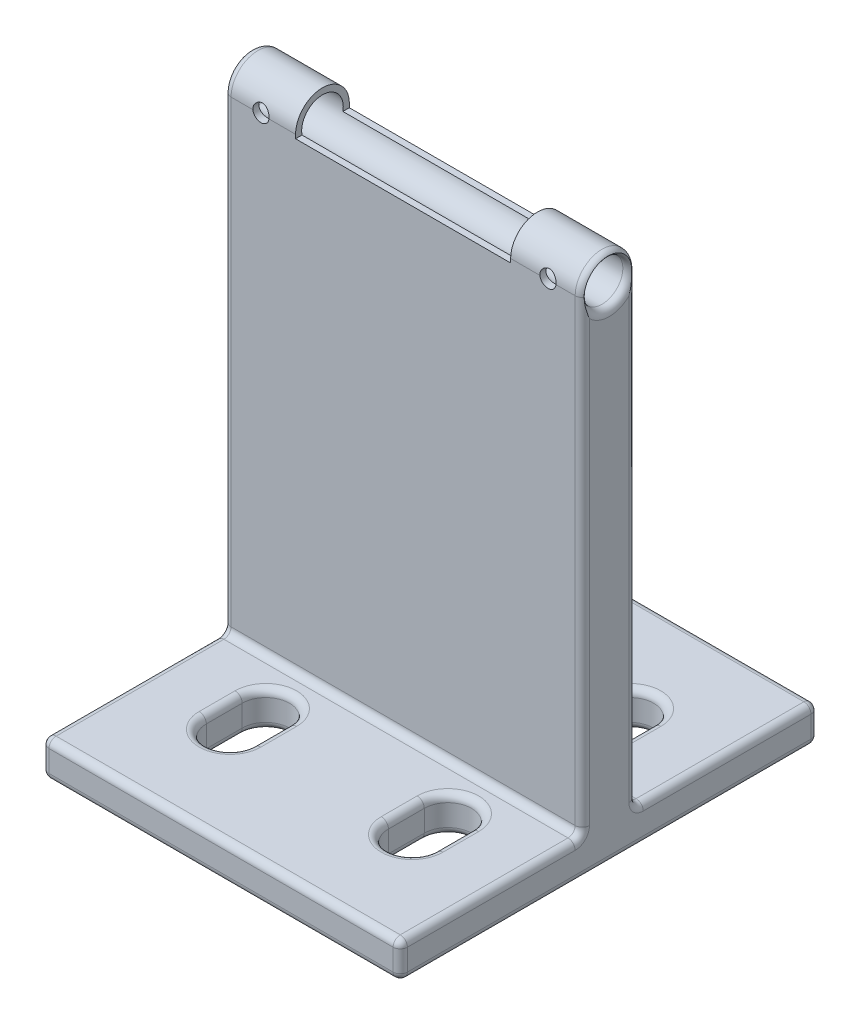
from build123d import *

# Parameters (mm, degrees)
SKETCH1_R                = 2.9
BOSS_EXTRUDE1_DEPTH      = 50
SKETCH2_W                = 30
SKETCH2_H                = 6.129245945
CUT_EXTRUDE1_DEPTH       = 50
BOSS_EXTRUDE2_DEPTH      = 25.4
BOSS_EXTRUDE2_DEPTH_BACK = 32.9
SKETCH3_W                = 50
SKETCH3_H                = 5
CUT_EXTRUDE2_DEPTH       = 25.4
F_4_40_SCREW_R           = 1.1303
CUT_EXTRUDE5_DEPTH       = 84.068274931
FILLET2_R                = 1


with BuildPart() as part:
    # Sketch1 → Boss-Extrude1 (new body)
    with BuildSketch(Plane(origin=(0, 0, 0), x_dir=(0, 0, -1), z_dir=(1, 0, 0))):
        with BuildLine():
            Line((-8.071724478, 6.76056338), (-8.071724478, -16.478873239))
            Line((-8.071724478, -16.478873239), (-0.571724478, -16.478873239))
            Line((-0.571724478, -16.478873239), (-0.571724478, 6.76056338))
            Line((-0.571724478, 6.76056338), (-0.571724478, 53.521126761))
            ThreePointArc((-0.571724478, 53.521126761), (-4.321724478, 57.271126761), (-8.071724478, 53.521126761))
            Line((-8.071724478, 53.521126761), (-8.071724478, 6.76056338))
        make_face()
        with Locations((-4.321724478, 53.521126761)):
            Circle(SKETCH1_R, mode=Mode.SUBTRACT)
    extrude(amount=BOSS_EXTRUDE1_DEPTH)

    # Sketch2 → Cut-Extrude1 (cut)
    with BuildSketch(Plane.XY.offset(8.071724478)):
        with Locations((25, 56.047993435)):
            Rectangle(SKETCH2_W, SKETCH2_H)
    extrude(amount=-CUT_EXTRUDE1_DEPTH, mode=Mode.SUBTRACT)

    # Sketch3 → Boss-Extrude2 (add, two sides: drawn at the far end of the back side and taken through both)
    with BuildSketch(Plane.XY.offset(8.071724478).offset(-BOSS_EXTRUDE2_DEPTH_BACK)):
        with Locations((25, -13.978873239)):
            Rectangle(SKETCH3_W, SKETCH3_H)
    extrude(amount=BOSS_EXTRUDE2_DEPTH + BOSS_EXTRUDE2_DEPTH_BACK)

    # Sketch4 → Cut-Extrude2 (cut)
    with BuildSketch(Plane.XZ.offset(16.478873239)):
        with BuildLine():
            Line((34.4, -10.878275522), (34.4, -5.878275522))
            ThreePointArc((34.4, -5.878275522), (37.7, -2.578275522), (41, -5.878275522))
            Line((41, -5.878275522), (41, -10.878275522))
            ThreePointArc((41, -10.878275522), (37.7, -14.178275522), (34.4, -10.878275522))
        make_face()
        with BuildLine():
            Line((9, -10.878275522), (9, -5.878275522))
            ThreePointArc((9, -5.878275522), (12.3, -2.578275522), (15.6, -5.878275522))
            Line((15.6, -5.878275522), (15.6, -10.878275522))
            ThreePointArc((15.6, -10.878275522), (12.3, -14.178275522), (9, -10.878275522))
        make_face()
        with BuildLine():
            Line((34.4, 14.521724478), (34.4, 19.521724478))
            ThreePointArc((34.4, 19.521724478), (37.7, 22.821724478), (41, 19.521724478))
            Line((41, 19.521724478), (41, 14.521724478))
            ThreePointArc((41, 14.521724478), (37.7, 11.221724478), (34.4, 14.521724478))
        make_face()
        with BuildLine():
            Line((9, 14.521724478), (9, 19.521724478))
            ThreePointArc((9, 19.521724478), (12.3, 22.821724478), (15.6, 19.521724478))
            Line((15.6, 19.521724478), (15.6, 14.521724478))
            ThreePointArc((15.6, 14.521724478), (12.3, 11.221724478), (9, 14.521724478))
        make_face()
    extrude(amount=-CUT_EXTRUDE2_DEPTH, mode=Mode.SUBTRACT)

    # 4-40 screw → Cut-Extrude5 (cut, through all)
    with BuildSketch(Plane.XY):
        with Locations(Location((45.202679855, 53.6471646, 0), (0, 0, 180))):
            Circle(F_4_40_SCREW_R)
        with Locations(Location((5.165796807, 53.6471646, 0), (0, 0, 353.597729853))):
            Circle(F_4_40_SCREW_R)
    extrude(amount=CUT_EXTRUDE5_DEPTH, mode=Mode.SUBTRACT)

    # Fillet2
    # the kernel refuses this fillet: 1 mm, written as the material it adds along each edge
    with BuildSketch(Plane(origin=(0, -11.478873239, 0.571724478), x_dir=(0, 0, -1), z_dir=(1, 0, 0))) as fillet2_piece_1:
        with BuildLine():
            CenterArc((FILLET2_R, FILLET2_R), FILLET2_R, 180, 90)
            Line((0, FILLET2_R), (0, 0))
            Line((0, 0), (FILLET2_R, 0))
        make_face()
    extrude(amount=50)
    with BuildSketch(Plane(origin=(50, -11.478873239, 8.071724478), x_dir=(0, 1, 0), z_dir=(-1, 0, 0))) as fillet2_piece_2:
        with BuildLine():
            CenterArc((FILLET2_R, -FILLET2_R), FILLET2_R, 90, 90)
            Line((0, -FILLET2_R), (0, 0))
            Line((0, 0), (FILLET2_R, 0))
        make_face()
    extrude(amount=50)
    # the kernel refuses this fillet: 1 mm, written as the material it takes off along each edge
    with BuildSketch(Plane(origin=(49, -15.478873239, -23.828275522), x_dir=(0, 0, -1), z_dir=(0, -1, 0))) as fillet2_2_piece_1_section:
        Polygon((0, 0), (FILLET2_R, 0), (FILLET2_R, FILLET2_R), (0, FILLET2_R), align=None)
    fillet2_2_piece_1 = extrude(amount=FILLET2_R, mode=Mode.PRIVATE)
    fillet2_2_piece_1 = fillet2_2_piece_1 - Plane(origin=(49, -15.478873239, -23.828275522), x_dir=(-0.7071067811865475, 0, 0.7071067811865475), z_dir=(0, -1, 0)) * Sphere(FILLET2_R, mode=Mode.PRIVATE)
    add(fillet2_2_piece_1, mode=Mode.SUBTRACT)
    with BuildSketch(Plane(origin=(49, -15.478873239, 32.471724478), x_dir=(0, 0, 1), z_dir=(0, -1, 0))) as fillet2_2_piece_2_section:
        Polygon((0, 0), (FILLET2_R, 0), (FILLET2_R, -FILLET2_R), (0, -FILLET2_R), align=None)
    fillet2_2_piece_2 = extrude(amount=FILLET2_R, mode=Mode.PRIVATE)
    fillet2_2_piece_2 = fillet2_2_piece_2 - Plane(origin=(49, -15.478873239, 32.471724478), x_dir=(-0.7071067811865475, 0, -0.7071067811865475), z_dir=(0, -1, 0)) * Sphere(FILLET2_R, mode=Mode.PRIVATE)
    add(fillet2_2_piece_2, mode=Mode.SUBTRACT)
    with BuildSketch(Plane(origin=(1, -12.478873239, -23.828275522), x_dir=(0, 0, -1), z_dir=(-1, 0, 0))) as fillet2_2_piece_3_section:
        Polygon((0, 0), (FILLET2_R, 0), (FILLET2_R, -FILLET2_R), (0, -FILLET2_R), align=None)
    fillet2_2_piece_3 = extrude(amount=FILLET2_R, mode=Mode.PRIVATE)
    fillet2_2_piece_3 = fillet2_2_piece_3 - Plane(origin=(1, -12.478873239, -23.828275522), x_dir=(0, -0.7071067811865475, 0.7071067811865475), z_dir=(-1, 0, 0)) * Sphere(FILLET2_R, mode=Mode.PRIVATE)
    add(fillet2_2_piece_3, mode=Mode.SUBTRACT)
    with BuildSketch(Plane(origin=(1, -15.478873239, -23.828275522), x_dir=(-1, 0, 0), z_dir=(0, -1, 0))) as fillet2_2_piece_4_section:
        Polygon((0, 0), (FILLET2_R, 0), (FILLET2_R, FILLET2_R), (0, FILLET2_R), align=None)
    fillet2_2_piece_4 = extrude(amount=FILLET2_R, mode=Mode.PRIVATE)
    fillet2_2_piece_4 = fillet2_2_piece_4 - Plane(origin=(1, -15.478873239, -23.828275522), x_dir=(0.7071067811865475, 0, 0.7071067811865475), z_dir=(0, -1, 0)) * Sphere(FILLET2_R, mode=Mode.PRIVATE)
    add(fillet2_2_piece_4, mode=Mode.SUBTRACT)
    with BuildSketch(Plane(origin=(1, -12.478873239, 32.471724478), x_dir=(0, 0, 1), z_dir=(-1, 0, 0))) as fillet2_2_piece_5_section:
        Polygon((0, 0), (FILLET2_R, 0), (FILLET2_R, FILLET2_R), (0, FILLET2_R), align=None)
    fillet2_2_piece_5 = extrude(amount=FILLET2_R, mode=Mode.PRIVATE)
    fillet2_2_piece_5 = fillet2_2_piece_5 - Plane(origin=(1, -12.478873239, 32.471724478), x_dir=(0, -0.7071067811865475, -0.7071067811865475), z_dir=(-1, 0, 0)) * Sphere(FILLET2_R, mode=Mode.PRIVATE)
    add(fillet2_2_piece_5, mode=Mode.SUBTRACT)
    with BuildSketch(Plane(origin=(49, -12.478873239, -23.828275522), x_dir=(1, 0, 0), z_dir=(0, 0, -1))) as fillet2_2_piece_6_section:
        Polygon((0, 0), (FILLET2_R, 0), (FILLET2_R, -FILLET2_R), (0, -FILLET2_R), align=None)
    fillet2_2_piece_6 = extrude(amount=FILLET2_R, mode=Mode.PRIVATE)
    fillet2_2_piece_6 = fillet2_2_piece_6 - Plane(origin=(49, -12.478873239, -23.828275522), x_dir=(-0.7071067811865475, -0.7071067811865475, 0), z_dir=(0, 0, -1)) * Sphere(FILLET2_R, mode=Mode.PRIVATE)
    add(fillet2_2_piece_6, mode=Mode.SUBTRACT)
    with BuildSketch(Plane(origin=(49, -12.478873239, 32.471724478), x_dir=(0, 0, 1), z_dir=(0, 1, 0))) as fillet2_2_piece_7_section:
        Polygon((0, 0), (FILLET2_R, 0), (FILLET2_R, FILLET2_R), (0, FILLET2_R), align=None)
    fillet2_2_piece_7 = extrude(amount=FILLET2_R, mode=Mode.PRIVATE)
    fillet2_2_piece_7 = fillet2_2_piece_7 - Plane(origin=(49, -12.478873239, 32.471724478), x_dir=(-0.7071067811865475, 0, -0.7071067811865475), z_dir=(0, 1, 0)) * Sphere(FILLET2_R, mode=Mode.PRIVATE)
    add(fillet2_2_piece_7, mode=Mode.SUBTRACT)
    with BuildSketch(Plane(origin=(1, -15.478873239, 32.471724478), x_dir=(-1, 0, 0), z_dir=(0, -1, 0))) as fillet2_2_piece_8_section:
        Polygon((0, 0), (FILLET2_R, 0), (FILLET2_R, -FILLET2_R), (0, -FILLET2_R), align=None)
    fillet2_2_piece_8 = extrude(amount=FILLET2_R, mode=Mode.PRIVATE)
    fillet2_2_piece_8 = fillet2_2_piece_8 - Plane(origin=(1, -15.478873239, 32.471724478), x_dir=(0.7071067811865475, 0, -0.7071067811865475), z_dir=(0, -1, 0)) * Sphere(FILLET2_R, mode=Mode.PRIVATE)
    add(fillet2_2_piece_8, mode=Mode.SUBTRACT)
    with BuildSketch(Plane(origin=(50, -16.478873239, -23.828275522), x_dir=(-1, 0, 0), z_dir=(0, 0, 1)), Plane(origin=(0, -16.478873239, 32.471724478), x_dir=(1, 0, 0), z_dir=(0, 0, -1))) as fillet2_2_piece_9:
        with BuildLine():
            CenterArc((FILLET2_R, -FILLET2_R), FILLET2_R, 90, 90)
            Line((0, -FILLET2_R), (0, 0))
            Line((0, 0), (FILLET2_R, 0))
        make_face()
    extrude(amount=56.3, mode=Mode.SUBTRACT)
    with BuildSketch(Plane(origin=(41, -11.478873239, 19.521724478), x_dir=(0, -1, 0), z_dir=(0, 0, -1)), Plane(origin=(34.4, -11.478873239, 14.521724478), x_dir=(0, -1, 0), z_dir=(0, 0, 1)), Plane(origin=(41, -16.478873239, 19.521724478), x_dir=(1, 0, 0), z_dir=(0, 0, -1)), Plane(origin=(34.4, -16.478873239, 14.521724478), x_dir=(-1, 0, 0), z_dir=(0, 0, 1)), Plane(origin=(15.6, -11.478873239, 19.521724478), x_dir=(0, -1, 0), z_dir=(0, 0, -1)), Plane(origin=(9, -11.478873239, 14.521724478), x_dir=(0, -1, 0), z_dir=(0, 0, 1)), Plane(origin=(15.6, -16.478873239, 19.521724478), x_dir=(1, 0, 0), z_dir=(0, 0, -1)), Plane(origin=(9, -16.478873239, 14.521724478), x_dir=(-1, 0, 0), z_dir=(0, 0, 1)), Plane(origin=(41, -11.478873239, -5.878275522), x_dir=(0, -1, 0), z_dir=(0, 0, -1)), Plane(origin=(34.4, -11.478873239, -10.878275522), x_dir=(0, -1, 0), z_dir=(0, 0, 1)), Plane(origin=(41, -16.478873239, -5.878275522), x_dir=(1, 0, 0), z_dir=(0, 0, -1)), Plane(origin=(34.4, -16.478873239, -10.878275522), x_dir=(-1, 0, 0), z_dir=(0, 0, 1)), Plane(origin=(15.6, -11.478873239, -5.878275522), x_dir=(0, -1, 0), z_dir=(0, 0, -1)), Plane(origin=(9, -11.478873239, -10.878275522), x_dir=(0, -1, 0), z_dir=(0, 0, 1)), Plane(origin=(15.6, -16.478873239, -5.878275522), x_dir=(1, 0, 0), z_dir=(0, 0, -1)), Plane(origin=(9, -16.478873239, -10.878275522), x_dir=(-1, 0, 0), z_dir=(0, 0, 1))) as fillet2_2_piece_10:
        with BuildLine():
            CenterArc((FILLET2_R, -FILLET2_R), FILLET2_R, 90, 90)
            Line((0, -FILLET2_R), (0, 0))
            Line((0, 0), (FILLET2_R, 0))
        make_face()
    extrude(amount=5, mode=Mode.SUBTRACT)
    with BuildSketch(Plane(origin=(37.7, -11.478873239, 19.521724478), x_dir=(1, 0, 0), z_dir=(0, 0, -1))) as fillet2_2_piece_11:
        with BuildLine():
            CenterArc((3.3 + FILLET2_R, FILLET2_R), FILLET2_R, 180, 90)
            Line((3.3 + FILLET2_R, 0), (3.3, 0))
            Line((3.3, 0), (3.3, FILLET2_R))
        make_face()
    revolve(axis=Axis((37.7, -11.478873239, 19.521724478), (0, -1, 0)), revolution_arc=180, mode=Mode.SUBTRACT)
    with BuildSketch(Plane(origin=(37.7, -11.478873239, 14.521724478), x_dir=(-1, 0, 0), z_dir=(0, 0, 1))) as fillet2_2_piece_12:
        with BuildLine():
            CenterArc((3.3 + FILLET2_R, FILLET2_R), FILLET2_R, 180, 90)
            Line((3.3 + FILLET2_R, 0), (3.3, 0))
            Line((3.3, 0), (3.3, FILLET2_R))
        make_face()
    revolve(axis=Axis((37.7, -11.478873239, 14.521724478), (0, -1, 0)), revolution_arc=180, mode=Mode.SUBTRACT)
    with BuildSketch(Plane(origin=(37.7, -16.478873239, 14.521724478), x_dir=(1, 0, 0), z_dir=(0, 0, 1))) as fillet2_2_piece_13:
        with BuildLine():
            CenterArc((3.3 + FILLET2_R, FILLET2_R), FILLET2_R, 180, 90)
            Line((3.3, FILLET2_R), (3.3, 0))
            Line((3.3, 0), (3.3 + FILLET2_R, 0))
        make_face()
    revolve(axis=Axis((37.7, -16.478873239, 14.521724478), (0, 1, 0)), revolution_arc=180, mode=Mode.SUBTRACT)
    with BuildSketch(Plane(origin=(37.7, -16.478873239, 19.521724478), x_dir=(-1, 0, 0), z_dir=(0, 0, -1))) as fillet2_2_piece_14:
        with BuildLine():
            CenterArc((3.3 + FILLET2_R, FILLET2_R), FILLET2_R, 180, 90)
            Line((3.3, FILLET2_R), (3.3, 0))
            Line((3.3, 0), (3.3 + FILLET2_R, 0))
        make_face()
    revolve(axis=Axis((37.7, -16.478873239, 19.521724478), (0, 1, 0)), revolution_arc=180, mode=Mode.SUBTRACT)
    with BuildSketch(Plane(origin=(12.3, -11.478873239, 19.521724478), x_dir=(1, 0, 0), z_dir=(0, 0, -1))) as fillet2_2_piece_15:
        with BuildLine():
            CenterArc((3.3 + FILLET2_R, FILLET2_R), FILLET2_R, 180, 90)
            Line((3.3 + FILLET2_R, 0), (3.3, 0))
            Line((3.3, 0), (3.3, FILLET2_R))
        make_face()
    revolve(axis=Axis((12.3, -11.478873239, 19.521724478), (0, -1, 0)), revolution_arc=180, mode=Mode.SUBTRACT)
    with BuildSketch(Plane(origin=(12.3, -11.478873239, 14.521724478), x_dir=(-1, 0, 0), z_dir=(0, 0, 1))) as fillet2_2_piece_16:
        with BuildLine():
            CenterArc((3.3 + FILLET2_R, FILLET2_R), FILLET2_R, 180, 90)
            Line((3.3 + FILLET2_R, 0), (3.3, 0))
            Line((3.3, 0), (3.3, FILLET2_R))
        make_face()
    revolve(axis=Axis((12.3, -11.478873239, 14.521724478), (0, -1, 0)), revolution_arc=180, mode=Mode.SUBTRACT)
    with BuildSketch(Plane(origin=(12.3, -16.478873239, 14.521724478), x_dir=(1, 0, 0), z_dir=(0, 0, 1))) as fillet2_2_piece_17:
        with BuildLine():
            CenterArc((3.3 + FILLET2_R, FILLET2_R), FILLET2_R, 180, 90)
            Line((3.3, FILLET2_R), (3.3, 0))
            Line((3.3, 0), (3.3 + FILLET2_R, 0))
        make_face()
    revolve(axis=Axis((12.3, -16.478873239, 14.521724478), (0, 1, 0)), revolution_arc=180, mode=Mode.SUBTRACT)
    with BuildSketch(Plane(origin=(12.3, -16.478873239, 19.521724478), x_dir=(-1, 0, 0), z_dir=(0, 0, -1))) as fillet2_2_piece_18:
        with BuildLine():
            CenterArc((3.3 + FILLET2_R, FILLET2_R), FILLET2_R, 180, 90)
            Line((3.3, FILLET2_R), (3.3, 0))
            Line((3.3, 0), (3.3 + FILLET2_R, 0))
        make_face()
    revolve(axis=Axis((12.3, -16.478873239, 19.521724478), (0, 1, 0)), revolution_arc=180, mode=Mode.SUBTRACT)
    with BuildSketch(Plane(origin=(0, 53.521126761, 4.321724478), x_dir=(0, 0, -1), z_dir=(0, -1, 0))) as fillet2_2_piece_19:
        with BuildLine():
            CenterArc((2.9 + FILLET2_R, FILLET2_R), FILLET2_R, 180, 90)
            Line((2.9, FILLET2_R), (2.9, 0))
            Line((2.9, 0), (2.9 + FILLET2_R, 0))
        make_face()
    revolve(axis=Axis((0, 53.521126761, 4.321724478), (1, 0, 0)), mode=Mode.SUBTRACT)
    with BuildSketch(Plane(origin=(50, 53.521126761, 4.321724478), x_dir=(0, 0, -1), z_dir=(0, -1, 0))) as fillet2_2_piece_20:
        with BuildLine():
            CenterArc((2.9 + FILLET2_R, -FILLET2_R), FILLET2_R, 90, 90)
            Line((2.9, -FILLET2_R), (2.9, 0))
            Line((2.9, 0), (2.9 + FILLET2_R, 0))
        make_face()
    revolve(axis=Axis((50, 53.521126761, 4.321724478), (1, 0, 0)), mode=Mode.SUBTRACT)
    with BuildSketch(Plane(origin=(50, 53.521126761, 4.321724478), x_dir=(0, 0, -1), z_dir=(0, -1, 0))) as fillet2_2_piece_21:
        with BuildLine():
            CenterArc((3.75 - FILLET2_R, -FILLET2_R), FILLET2_R, 0, 90)
            Line((3.75, -FILLET2_R), (3.75, 0))
            Line((3.75, 0), (3.75 - FILLET2_R, 0))
        make_face()
    revolve(axis=Axis((50, 53.521126761, 4.321724478), (1, 0, 0)), revolution_arc=180, mode=Mode.SUBTRACT)
    with BuildSketch(Plane(origin=(50, -10.478873239, 8.071724478), x_dir=(0, 0, -1), z_dir=(0, 1, 0)), Plane(origin=(50, 53.521126761, 0.571724478), x_dir=(0, 0, 1), z_dir=(0, -1, 0)), Plane(origin=(0, -10.478873239, 0.571724478), x_dir=(0, 0, 1), z_dir=(0, 1, 0)), Plane(origin=(0, 53.521126761, 8.071724478), x_dir=(0, 0, -1), z_dir=(0, -1, 0))) as fillet2_2_piece_22:
        with BuildLine():
            CenterArc((FILLET2_R, FILLET2_R), FILLET2_R, 180, 90)
            Line((0, FILLET2_R), (0, 0))
            Line((0, 0), (FILLET2_R, 0))
        make_face()
    extrude(amount=64, mode=Mode.SUBTRACT)
    with BuildSketch(Plane(origin=(0, -12.478873239, -24.828275522), x_dir=(0, 0, 1), z_dir=(0, -1, 0)), Plane(origin=(50, -15.478873239, 33.471724478), x_dir=(-1, 0, 0), z_dir=(0, 1, 0))) as fillet2_2_piece_23:
        with BuildLine():
            CenterArc((FILLET2_R, -FILLET2_R), FILLET2_R, 90, 90)
            Line((0, -FILLET2_R), (0, 0))
            Line((0, 0), (FILLET2_R, 0))
        make_face()
    extrude(amount=3, mode=Mode.SUBTRACT)
    with BuildSketch(Plane(origin=(0, -11.478873239, 32.471724478), x_dir=(0, -1, 0), z_dir=(0, 0, -1)), Plane(origin=(0, -11.478873239, -0.428275522), x_dir=(0, -1, 0), z_dir=(0, 0, -1)), Plane(origin=(50, -11.478873239, 9.071724478), x_dir=(0, -1, 0), z_dir=(0, 0, 1)), Plane(origin=(50, -11.478873239, -23.828275522), x_dir=(0, -1, 0), z_dir=(0, 0, 1))) as fillet2_2_piece_24:
        with BuildLine():
            CenterArc((FILLET2_R, -FILLET2_R), FILLET2_R, 90, 90)
            Line((0, -FILLET2_R), (0, 0))
            Line((0, 0), (FILLET2_R, 0))
        make_face()
    extrude(amount=23.4, mode=Mode.SUBTRACT)
    with BuildSketch(Plane(origin=(49, -11.478873239, -24.828275522), x_dir=(0, -1, 0), z_dir=(-1, 0, 0)), Plane(origin=(1, -16.478873239, 33.471724478), x_dir=(0, 0, -1), z_dir=(1, 0, 0))) as fillet2_2_piece_25:
        with BuildLine():
            CenterArc((FILLET2_R, FILLET2_R), FILLET2_R, 180, 90)
            Line((0, FILLET2_R), (0, 0))
            Line((0, 0), (FILLET2_R, 0))
        make_face()
    extrude(amount=48, mode=Mode.SUBTRACT)
    with BuildSketch(Plane(origin=(50, -15.478873239, -24.828275522), x_dir=(-1, 0, 0), z_dir=(0, 1, 0)), Plane(origin=(0, -12.478873239, 33.471724478), x_dir=(0, 0, -1), z_dir=(0, -1, 0))) as fillet2_2_piece_26:
        with BuildLine():
            CenterArc((FILLET2_R, FILLET2_R), FILLET2_R, 180, 90)
            Line((0, FILLET2_R), (0, 0))
            Line((0, 0), (FILLET2_R, 0))
        make_face()
    extrude(amount=3, mode=Mode.SUBTRACT)
    with BuildSketch(Plane(origin=(1, -16.478873239, -24.828275522), x_dir=(0, 0, 1), z_dir=(1, 0, 0)), Plane(origin=(49, -11.478873239, 33.471724478), x_dir=(0, -1, 0), z_dir=(-1, 0, 0))) as fillet2_2_piece_27:
        with BuildLine():
            CenterArc((FILLET2_R, -FILLET2_R), FILLET2_R, 90, 90)
            Line((0, -FILLET2_R), (0, 0))
            Line((0, 0), (FILLET2_R, 0))
        make_face()
    extrude(amount=48, mode=Mode.SUBTRACT)
    with BuildSketch(Plane(origin=(0, 53.521126761, 4.321724478), x_dir=(0, 0, -1), z_dir=(0, -1, 0))) as fillet2_2_piece_28:
        with BuildLine():
            CenterArc((3.75 - FILLET2_R, FILLET2_R), FILLET2_R, 270, 90)
            Line((3.75, FILLET2_R), (3.75, 0))
            Line((3.75, 0), (3.75 - FILLET2_R, 0))
        make_face()
    revolve(axis=Axis((0, 53.521126761, 4.321724478), (1, 0, 0)), revolution_arc=180, mode=Mode.SUBTRACT)
    with BuildSketch(Plane(origin=(37.7, -11.478873239, -5.878275522), x_dir=(1, 0, 0), z_dir=(0, 0, -1))) as fillet2_2_piece_29:
        with BuildLine():
            CenterArc((3.3 + FILLET2_R, FILLET2_R), FILLET2_R, 180, 90)
            Line((3.3 + FILLET2_R, 0), (3.3, 0))
            Line((3.3, 0), (3.3, FILLET2_R))
        make_face()
    revolve(axis=Axis((37.7, -11.478873239, -5.878275522), (0, -1, 0)), revolution_arc=180, mode=Mode.SUBTRACT)
    with BuildSketch(Plane(origin=(37.7, -11.478873239, -10.878275522), x_dir=(-1, 0, 0), z_dir=(0, 0, 1))) as fillet2_2_piece_30:
        with BuildLine():
            CenterArc((3.3 + FILLET2_R, FILLET2_R), FILLET2_R, 180, 90)
            Line((3.3 + FILLET2_R, 0), (3.3, 0))
            Line((3.3, 0), (3.3, FILLET2_R))
        make_face()
    revolve(axis=Axis((37.7, -11.478873239, -10.878275522), (0, -1, 0)), revolution_arc=180, mode=Mode.SUBTRACT)
    with BuildSketch(Plane(origin=(37.7, -16.478873239, -10.878275522), x_dir=(1, 0, 0), z_dir=(0, 0, 1))) as fillet2_2_piece_31:
        with BuildLine():
            CenterArc((3.3 + FILLET2_R, FILLET2_R), FILLET2_R, 180, 90)
            Line((3.3, FILLET2_R), (3.3, 0))
            Line((3.3, 0), (3.3 + FILLET2_R, 0))
        make_face()
    revolve(axis=Axis((37.7, -16.478873239, -10.878275522), (0, 1, 0)), revolution_arc=180, mode=Mode.SUBTRACT)
    with BuildSketch(Plane(origin=(37.7, -16.478873239, -5.878275522), x_dir=(-1, 0, 0), z_dir=(0, 0, -1))) as fillet2_2_piece_32:
        with BuildLine():
            CenterArc((3.3 + FILLET2_R, FILLET2_R), FILLET2_R, 180, 90)
            Line((3.3, FILLET2_R), (3.3, 0))
            Line((3.3, 0), (3.3 + FILLET2_R, 0))
        make_face()
    revolve(axis=Axis((37.7, -16.478873239, -5.878275522), (0, 1, 0)), revolution_arc=180, mode=Mode.SUBTRACT)
    with BuildSketch(Plane(origin=(12.3, -11.478873239, -5.878275522), x_dir=(1, 0, 0), z_dir=(0, 0, -1))) as fillet2_2_piece_33:
        with BuildLine():
            CenterArc((3.3 + FILLET2_R, FILLET2_R), FILLET2_R, 180, 90)
            Line((3.3 + FILLET2_R, 0), (3.3, 0))
            Line((3.3, 0), (3.3, FILLET2_R))
        make_face()
    revolve(axis=Axis((12.3, -11.478873239, -5.878275522), (0, -1, 0)), revolution_arc=180, mode=Mode.SUBTRACT)
    with BuildSketch(Plane(origin=(12.3, -11.478873239, -10.878275522), x_dir=(-1, 0, 0), z_dir=(0, 0, 1))) as fillet2_2_piece_34:
        with BuildLine():
            CenterArc((3.3 + FILLET2_R, FILLET2_R), FILLET2_R, 180, 90)
            Line((3.3 + FILLET2_R, 0), (3.3, 0))
            Line((3.3, 0), (3.3, FILLET2_R))
        make_face()
    revolve(axis=Axis((12.3, -11.478873239, -10.878275522), (0, -1, 0)), revolution_arc=180, mode=Mode.SUBTRACT)
    with BuildSketch(Plane(origin=(12.3, -16.478873239, -10.878275522), x_dir=(1, 0, 0), z_dir=(0, 0, 1))) as fillet2_2_piece_35:
        with BuildLine():
            CenterArc((3.3 + FILLET2_R, FILLET2_R), FILLET2_R, 180, 90)
            Line((3.3, FILLET2_R), (3.3, 0))
            Line((3.3, 0), (3.3 + FILLET2_R, 0))
        make_face()
    revolve(axis=Axis((12.3, -16.478873239, -10.878275522), (0, 1, 0)), revolution_arc=180, mode=Mode.SUBTRACT)
    with BuildSketch(Plane(origin=(12.3, -16.478873239, -5.878275522), x_dir=(-1, 0, 0), z_dir=(0, 0, -1))) as fillet2_2_piece_36:
        with BuildLine():
            CenterArc((3.3 + FILLET2_R, FILLET2_R), FILLET2_R, 180, 90)
            Line((3.3, FILLET2_R), (3.3, 0))
            Line((3.3, 0), (3.3 + FILLET2_R, 0))
        make_face()
    revolve(axis=Axis((12.3, -16.478873239, -5.878275522), (0, 1, 0)), revolution_arc=180, mode=Mode.SUBTRACT)
    with BuildSketch(Plane(origin=(0, -10.478873239, 9.071724478), x_dir=(0, 0, -1), z_dir=(0, 1, 0))) as fillet2_2_piece_37:
        with BuildLine():
            CenterArc((1 + FILLET2_R, -FILLET2_R), FILLET2_R, 90, 90)
            Line((1, -FILLET2_R), (1, 0))
            Line((1, 0), (1 + FILLET2_R, 0))
        make_face()
    revolve(axis=Axis((0, -10.478873239, 9.071724478), (-1, 0, 0)), revolution_arc=90, mode=Mode.SUBTRACT)
    with BuildSketch(Plane(origin=(50, -10.478873239, -0.428275522), x_dir=(0, -1, 0), z_dir=(0, 0, -1))) as fillet2_2_piece_38:
        with BuildLine():
            CenterArc((1 + FILLET2_R, FILLET2_R), FILLET2_R, 180, 90)
            Line((1, FILLET2_R), (1, 0))
            Line((1, 0), (1 + FILLET2_R, 0))
        make_face()
    revolve(axis=Axis((50, -10.478873239, -0.428275522), (-1, 0, 0)), revolution_arc=90, mode=Mode.SUBTRACT)
    with BuildSketch(Plane(origin=(50, -10.478873239, 9.071724478), x_dir=(0, 0, -1), z_dir=(0, 1, 0))) as fillet2_2_piece_39:
        with BuildLine():
            CenterArc((1 + FILLET2_R, FILLET2_R), FILLET2_R, 180, 90)
            Line((1, FILLET2_R), (1, 0))
            Line((1, 0), (1 + FILLET2_R, 0))
        make_face()
    revolve(axis=Axis((50, -10.478873239, 9.071724478), (-1, 0, 0)), revolution_arc=90, mode=Mode.SUBTRACT)
    with BuildSketch(Plane(origin=(0, -10.478873239, -0.428275522), x_dir=(0, -1, 0), z_dir=(0, 0, -1))) as fillet2_2_piece_40:
        with BuildLine():
            CenterArc((1 + FILLET2_R, -FILLET2_R), FILLET2_R, 90, 90)
            Line((1, -FILLET2_R), (1, 0))
            Line((1, 0), (1 + FILLET2_R, 0))
        make_face()
    revolve(axis=Axis((0, -10.478873239, -0.428275522), (-1, 0, 0)), revolution_arc=90, mode=Mode.SUBTRACT)


solid = part.part
